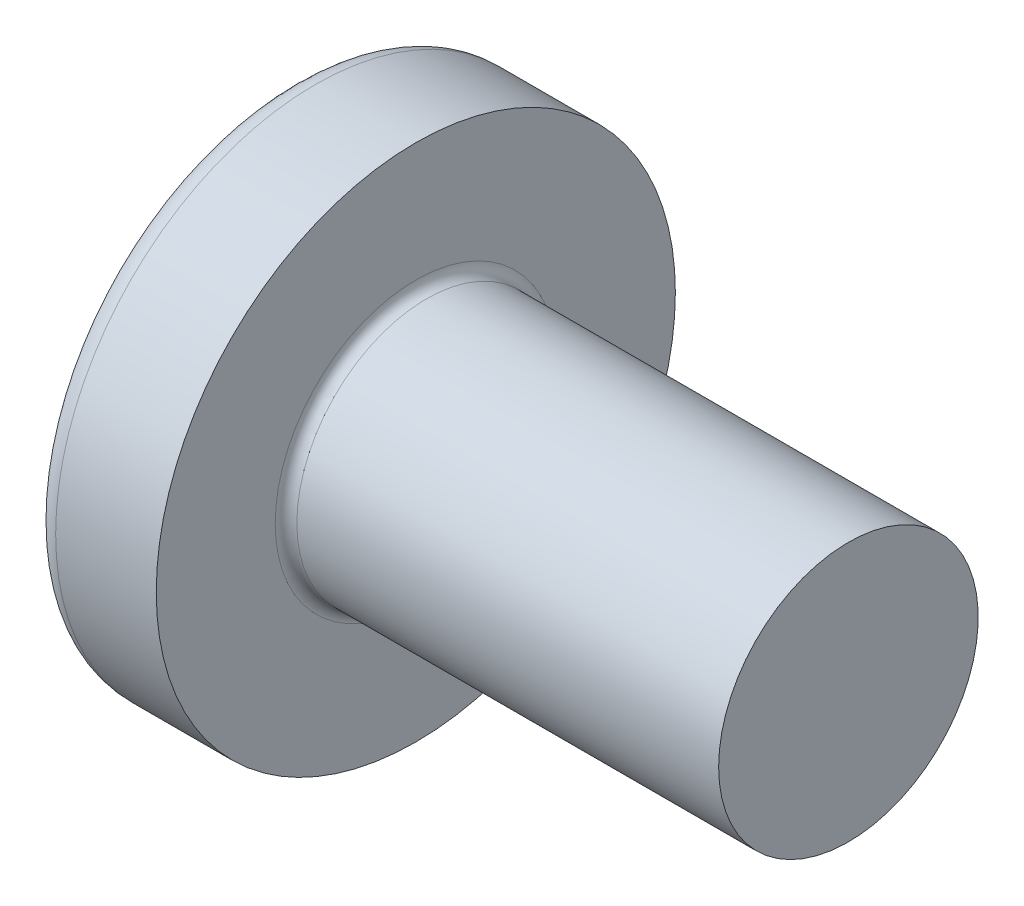
from build123d import *

# Parameters (mm, degrees)
RECPAT_COUNT = 2
RECPAT_ANGLE = 90


with BuildPart() as part:
    # Fillet1: read off the stored shape, not the designer's step
    # Fillet1 outline → Fillet1 (revolve)
    with BuildSketch(Plane.YX):
        with BuildLine():
            Line((3, 4.85), (3, 14.6))
            Line((3, 14.6), (0, 14.6))
            Line((0, 14.6), (0, 0))
            ThreePointArc((0, 0), (3.027985079, 0.469454036), (5.771670194, 1.833738728))
            ThreePointArc((5.771670194, 1.833738728), (5.939532013, 2.026424569), (6, 2.274716834))
            Line((6, 2.274716834), (6, 4.6))
            Line((6, 4.6), (3.25, 4.6))
            ThreePointArc((3.25, 4.6), (3.073223305, 4.673223305), (3, 4.85))
        make_face()
    revolve(axis=Axis((0, 0, 0), (1, 0, 0)))

    # Sketch3 → Recess section 0
    with BuildSketch(Plane(origin=(0, 0, 0), x_dir=(0, 0, -1), z_dir=(1, 0, 0))):
        with BuildLine():
            Line((0.71, -3.35), (-0.71, -3.35))
            Line((-0.71, -3.35), (-0.71, 3.35))
            Line((-0.71, 3.35), (0.71, 3.35))
            Line((0.71, 3.35), (0.71, -3.35))
        make_face()
    # Sketch4 → Recess section 1
    with BuildSketch(Plane(origin=(3.46, 0, 0), x_dir=(0, 0, -1), z_dir=(1, 0, 0))):
        with BuildLine():
            Line((0.71, -1.624907925), (-0.71, -1.624907925))
            Line((-0.71, -1.624907925), (-0.71, 1.624907925))
            Line((-0.71, 1.624907925), (0.71, 1.624907925))
            Line((0.71, 1.624907925), (0.71, -1.624907925))
        make_face()
    recess = loft(mode=Mode.SUBTRACT)

    # RecPat: Recess ×2 about axis
    recpat_axis = Axis((0, 0, 0), (1, 0, 0))
    for i in range(1, RECPAT_COUNT):
        add(recess.rotate(recpat_axis, i * RECPAT_ANGLE / (RECPAT_COUNT - 1)), mode=Mode.SUBTRACT)

    # RecCorSke → RecessCore (revolve, cut)
    with BuildSketch(Plane.XY, mode=Mode.PRIVATE) as recesscore_sk:
        Polygon((0, 0), (0, 1.522446769), (3.46, 1.2805), (3.876059671, 0), align=None)
    revolve(recesscore_sk.sketch.rotate(Axis((-3.175, 0, 0), (1, 0, 0)), 90), axis=Axis((-3.175, 0, 0), (1, 0, 0)), mode=Mode.SUBTRACT)


solid = part.part
